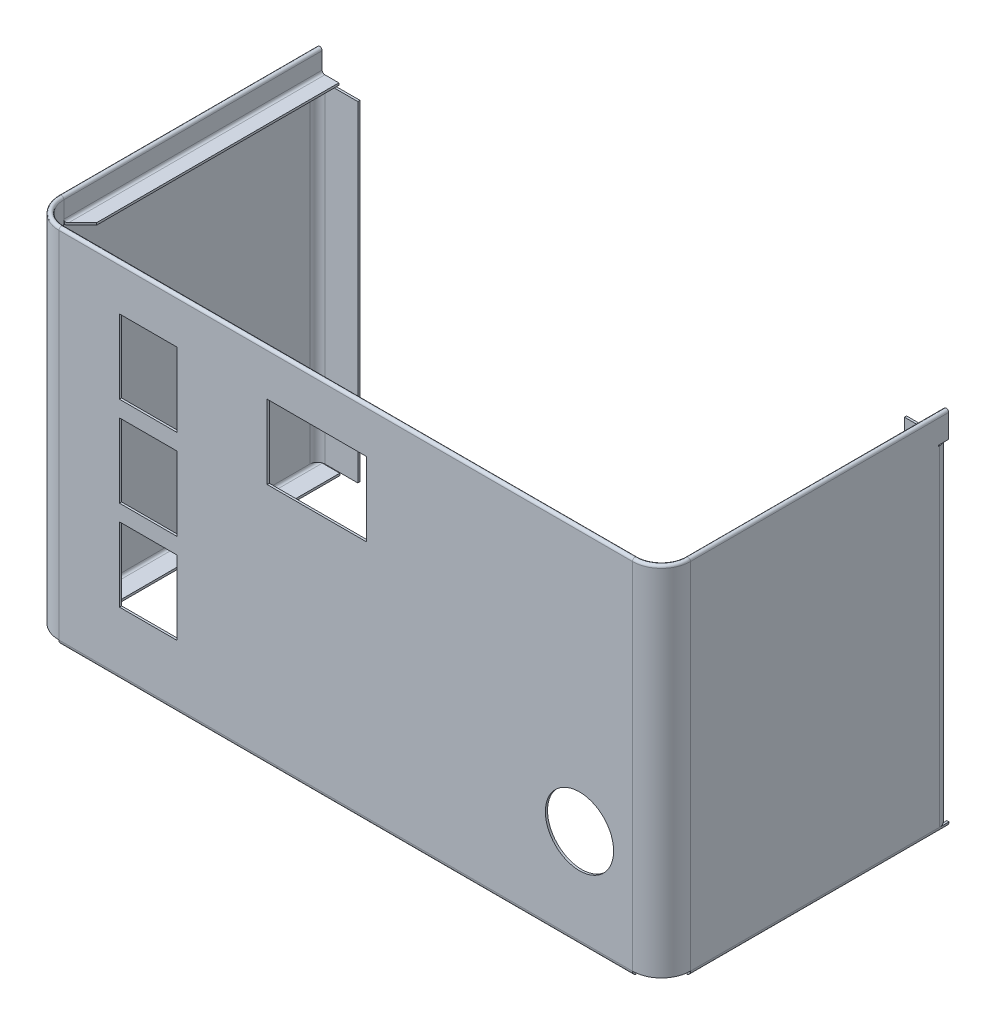
from build123d import *

# Parameters (mm, degrees)
BASE_FLANGE1_DEPTH        = 132
HEM2_START                = -107
HEM2_DEPTH                = 96.2
SKETCH31_R                = 12.7
CUT_EXTRUDE1_DEPTH        = 208.181817916
EDGE_FLANGE1_DEPTH        = 96.2
EDGE_FLANGE1_BEND_DEPTH   = 213.4
EDGE_FLANGE1_BEND_2_DEPTH = 96.2
CHAMFER1_SIZE             = 7
SKETCH41_W                = 21.5
SKETCH41_H                = 27.5
CUT_EXTRUDE2_DEPTH        = 208.181817916
LPATTERN1_COUNT           = 3
LPATTERN1_PITCH           = 33.5
SKETCH44_W                = 235
SKETCH44_H                = 10
CUT_EXTRUDE3_DEPTH        = 0.1
EDGE_FLANGE2_DEPTH        = 123.325
EDGE_FLANGE2_START        = 122.925
EDGE_FLANGE2_2_DEPTH      = 0.4
EDGE_FLANGE2_3_DEPTH      = 122.925
EDGE_FLANGE4_START        = -106.9
EDGE_FLANGE4_DEPTH        = 96.1
EDGE_FLANGE4_2_DEPTH      = 96.1
CHAMFER2_SIZE             = 6
SKETCH80_W                = 213.4
SKETCH80_H                = 1
BOSS_EXTRUDE1_DEPTH       = 7
FILLET1_R                 = 1
SKETCH92_W                = 37
SKETCH92_H                = 27.5
CUT_EXTRUDE4_DEPTH        = 208.181817916


# Read off the part's stored shape, not the designer's step: Hem2, Edge-Flange2, Edge-Flange4
# Sheet-metal steps are written as plain solids
with BuildPart() as part:
    # Sketch1 → Base-Flange1 (new body)
    with BuildSketch(Plane(origin=(0, 0, 0), x_dir=(1, 0, 0), z_dir=(0, 1, 0))):
        with BuildLine():
            Line((117.5, 107), (117.5, 10.8))
            ThreePointArc((117.5, 10.8), (114.336753237, 3.163246763), (106.7, 0))
            Line((106.7, 0), (0, 0))
            Line((0, 0), (-106.7, 0))
            ThreePointArc((-106.7, 0), (-114.336753237, 3.163246763), (-117.5, 10.8))
            Line((-117.5, 10.8), (-117.5, 107))
            Line((-117.5, 107), (-116.7, 107))
            Line((-116.7, 107), (-116.7, 10.8))
            ThreePointArc((-116.7, 10.8), (-113.771067812, 3.728932188), (-106.7, 0.8))
            Line((-106.7, 0.8), (0, 0.8))
            Line((0, 0.8), (106.7, 0.8))
            ThreePointArc((106.7, 0.8), (113.771067812, 3.728932188), (116.7, 10.8))
            Line((116.7, 10.8), (116.7, 107))
            Line((116.7, 107), (117.5, 107))
        make_face()
    extrude(amount=BASE_FLANGE1_DEPTH)

    # Hem2 outline → Hem2 (add)
    with BuildSketch(Plane.XY.offset(HEM2_START)):
        with BuildLine():
            Line((-116.45, 123.925), (-115.65, 123.925))
            Line((-115.65, 123.925), (-115.65, 132))
            ThreePointArc((-115.65, 132), (-116.575, 132.925), (-117.5, 132))
            Line((-117.5, 132), (-116.7, 132))
            ThreePointArc((-116.7, 132), (-116.575, 132.125), (-116.45, 132))
            Line((-116.45, 132), (-116.45, 123.925))
        make_face()
        with BuildLine():
            Line((115.65, 123.925), (116.45, 123.925))
            Line((116.45, 123.925), (116.45, 132))
            ThreePointArc((116.45, 132), (116.575, 132.125), (116.7, 132))
            Line((116.7, 132), (117.5, 132))
            ThreePointArc((117.5, 132), (116.575, 132.925), (115.65, 132))
            Line((115.65, 132), (115.65, 123.925))
        make_face()
    extrude(amount=HEM2_DEPTH)

    # Sweep1: sweep along a path in Sketch30
    with BuildLine(Plane(origin=(0, 132, 0), x_dir=(1, 0, 0), z_dir=(0, 1, 0))) as sweep1_path:
        ThreePointArc((-116.7, 10.8), (-113.771067812, 3.728932188), (-106.7, 0.8))
        Line((-106.7, 0.8), (106.7, 0.8))
        ThreePointArc((106.7, 0.8), (113.771067812, 3.728932188), (116.7, 10.8))
    # Sketch29 → Sweep1 (sweep)
    with BuildSketch(Plane.XY.offset(-10.8)):
        with BuildLine():
            Line((-117.5, 132), (-116.7, 132))
            ThreePointArc((-116.7, 132), (-116.575, 132.125), (-116.45, 132))
            Line((-116.45, 132), (-116.45, 123.925))
            Line((-116.45, 123.925), (-115.65, 123.925))
            Line((-115.65, 123.925), (-115.65, 132))
            ThreePointArc((-115.65, 132), (-116.575, 132.925), (-117.5, 132))
        make_face()
    sweep(path=sweep1_path.line)

    # Sketch31 → Cut-Extrude1 (cut, through all)
    with BuildSketch(Plane.XY):
        with Locations((87, 35.2)):
            Circle(SKETCH31_R)
    extrude(amount=-CUT_EXTRUDE1_DEPTH, mode=Mode.SUBTRACT)

    # Edge-Flange1 section (across the edge) → Edge-Flange1 (add)
    with BuildSketch(Plane(origin=(-116.7, -1, -10.8), x_dir=(0, 1, 0), z_dir=(0, 0, -1))):
        with BuildLine():
            Line((-0.8, 1), (-0.8, 7.5))
            Line((-0.8, 7.5), (0, 7.5))
            Line((0, 7.5), (0, 1))
            ThreePointArc((0, 1), (0.292893219, 0.292893219), (1, 0))
            Line((1, 0), (1, -0.8))
            ThreePointArc((1, -0.8), (-0.272792206, -0.272792206), (-0.8, 1))
        make_face()
    extrude(amount=EDGE_FLANGE1_DEPTH)

    # Edge-Flange1 section 2 (across the edge) → Edge-Flange1 bend (add)
    with BuildSketch(Plane(origin=(106.7, -1, -0.8), x_dir=(0, 1, 0), z_dir=(-1, 0, 0))):
        with BuildLine():
            Line((-0.8, 1), (-0.8, 7.5))
            Line((-0.8, 7.5), (0, 7.5))
            Line((0, 7.5), (0, 1))
            ThreePointArc((0, 1), (0.292893219, 0.292893219), (1, 0))
            Line((1, 0), (1, -0.8))
            ThreePointArc((1, -0.8), (-0.272792206, -0.272792206), (-0.8, 1))
        make_face()
    extrude(amount=EDGE_FLANGE1_BEND_DEPTH)

    # Edge-Flange1 section 3 (across the edge) → Edge-Flange1 bend 2 (add)
    with BuildSketch(Plane(origin=(116.7, -1, -107), x_dir=(0, 1, 0), z_dir=(0, 0, 1))):
        with BuildLine():
            Line((-0.8, 1), (-0.8, 7.5))
            Line((-0.8, 7.5), (0, 7.5))
            Line((0, 7.5), (0, 1))
            ThreePointArc((0, 1), (0.292893219, 0.292893219), (1, 0))
            Line((1, 0), (1, -0.8))
            ThreePointArc((1, -0.8), (-0.272792206, -0.272792206), (-0.8, 1))
        make_face()
    extrude(amount=EDGE_FLANGE1_BEND_2_DEPTH)

    # Chamfer1
    chamfer1_edges = [part.edges().sort_by_distance(p)[0] for p in [
        (106.7, -1.4, -8.3),
        (109.2, -1.4, -10.8),
        (-106.7, -1.4, -8.3),
        (-109.2, -1.4, -10.8),
    ]]
    chamfer(chamfer1_edges, length=CHAMFER1_SIZE)

    # Sketch41 → Cut-Extrude2 (cut, through all)
    with BuildSketch(Plane.XY):
        with Locations((-73.45, 102.6)):
            Rectangle(SKETCH41_W, SKETCH41_H)
    cut_extrude2 = extrude(amount=-CUT_EXTRUDE2_DEPTH, mode=Mode.SUBTRACT)

    # LPattern1: Cut-Extrude2 ×3
    with Locations(*[(0, -i * LPATTERN1_PITCH, 0) for i in range(1, LPATTERN1_COUNT)]):
        add(cut_extrude2, mode=Mode.SUBTRACT)

    # Sketch44 → Cut-Extrude3 (cut)
    with BuildSketch(Plane(origin=(0, 0, -107), x_dir=(-1, 0, 0), z_dir=(0, 0, -1))):
        with Locations((0, 127.925)):
            Rectangle(SKETCH44_W, SKETCH44_H)
    extrude(amount=-CUT_EXTRUDE3_DEPTH, mode=Mode.SUBTRACT)

    # Edge-Flange2 outline → Edge-Flange2 (cut)
    with BuildSketch(Plane(origin=(0, 0, 0), x_dir=(1, 0, 0), z_dir=(0, 1, 0))):
        with BuildLine():
            ThreePointArc((116.7, 105.662741699), (117.29411255, 104.6), (117.5, 103.4))
            Line((117.5, 103.4), (117.5, 107))
            Line((117.5, 107), (116.7, 107))
            Line((116.7, 107), (116.7, 105.662741699))
        make_face()
        with BuildLine():
            ThreePointArc((-117.5, 103.4), (-117.29411255, 104.6), (-116.7, 105.662741699))
            Line((-116.7, 105.662741699), (-116.7, 107))
            Line((-116.7, 107), (-117.5, 107))
            Line((-117.5, 107), (-117.5, 103.4))
        make_face()
    extrude(amount=EDGE_FLANGE2_DEPTH, mode=Mode.SUBTRACT)

    # Edge-Flange2 2 outline → Edge-Flange2 2 (cut)
    with BuildSketch(Plane(origin=(0, 0, 0), x_dir=(1, 0, 0), z_dir=(0, 1, 0)).offset(EDGE_FLANGE2_START)):
        with BuildLine():
            ThreePointArc((117.5, 103.4), (117.29411255, 104.6), (116.7, 105.662741699))
            Line((116.7, 105.662741699), (116.7, 103))
            Line((116.7, 103), (117.5, 103))
            Line((117.5, 103), (117.5, 103.4))
        make_face()
        with BuildLine():
            Line((-116.7, 103), (-116.7, 105.662741699))
            ThreePointArc((-116.7, 105.662741699), (-117.29411255, 104.6), (-117.5, 103.4))
            Line((-117.5, 103.4), (-117.5, 103))
            Line((-117.5, 103), (-116.7, 103))
        make_face()
    extrude(amount=EDGE_FLANGE2_2_DEPTH, mode=Mode.SUBTRACT)

    # Edge-Flange2 3 outline → Edge-Flange2 3 (add)
    with BuildSketch(Plane(origin=(0, 0, 0), x_dir=(1, 0, 0), z_dir=(0, 1, 0))):
        with BuildLine():
            Line((113.9, 107), (101.7, 107))
            Line((101.7, 107), (101.7, 106.2))
            Line((101.7, 106.2), (113.9, 106.2))
            ThreePointArc((113.9, 106.2), (115.879898987, 105.379898987), (116.7, 103.4))
            Line((116.7, 103.4), (116.7, 105.662741699))
            ThreePointArc((116.7, 105.662741699), (115.451471863, 106.648528137), (113.9, 107))
        make_face()
        with BuildLine():
            Line((-101.7, 107), (-113.9, 107))
            ThreePointArc((-113.9, 107), (-115.451471863, 106.648528137), (-116.7, 105.662741699))
            Line((-116.7, 105.662741699), (-116.7, 103.4))
            ThreePointArc((-116.7, 103.4), (-115.879898987, 105.379898987), (-113.9, 106.2))
            Line((-113.9, 106.2), (-101.7, 106.2))
            Line((-101.7, 106.2), (-101.7, 107))
        make_face()
    extrude(amount=EDGE_FLANGE2_3_DEPTH)

    # Edge-Flange4 outline → Edge-Flange4 (cut)
    with BuildSketch(Plane.XY.offset(EDGE_FLANGE4_START)):
        with BuildLine():
            ThreePointArc((116.45, 125.725), (116.237450787, 124.876471863), (115.65, 124.228337046))
            Line((115.65, 124.228337046), (115.65, 123.925))
            Line((115.65, 123.925), (116.45, 123.925))
            Line((116.45, 123.925), (116.45, 125.725))
        make_face()
        with BuildLine():
            Line((-115.65, 123.925), (-115.65, 124.228337046))
            ThreePointArc((-115.65, 124.228337046), (-116.237450787, 124.876471863), (-116.45, 125.725))
            Line((-116.45, 125.725), (-116.45, 123.925))
            Line((-116.45, 123.925), (-115.65, 123.925))
        make_face()
    extrude(amount=EDGE_FLANGE4_DEPTH, mode=Mode.SUBTRACT)

    # Edge-Flange4 2 outline → Edge-Flange4 2 (add)
    with BuildSketch(Plane.XY.offset(EDGE_FLANGE4_START)):
        with BuildLine():
            Line((109.45, 123.925), (114.65, 123.925))
            ThreePointArc((114.65, 123.925), (115.172497216, 124.002502784), (115.65, 124.228337046))
            Line((115.65, 124.228337046), (115.65, 125.725))
            ThreePointArc((115.65, 125.725), (115.357106781, 125.017893219), (114.65, 124.725))
            Line((114.65, 124.725), (109.45, 124.725))
            Line((109.45, 124.725), (109.45, 123.925))
        make_face()
        with BuildLine():
            Line((-114.65, 123.925), (-109.45, 123.925))
            Line((-109.45, 123.925), (-109.45, 124.725))
            Line((-109.45, 124.725), (-114.65, 124.725))
            ThreePointArc((-114.65, 124.725), (-115.357106781, 125.017893219), (-115.65, 125.725))
            Line((-115.65, 125.725), (-115.65, 124.228337046))
            ThreePointArc((-115.65, 124.228337046), (-115.172497216, 124.002502784), (-114.65, 123.925))
        make_face()
    extrude(amount=EDGE_FLANGE4_2_DEPTH)

    # Chamfer2
    chamfer2_edges = [part.edges().sort_by_distance(p)[0] for p in [
        (-109.45, 124.325, -10.8),
        (109.45, 124.325, -10.8),
    ]]
    chamfer(chamfer2_edges, length=CHAMFER2_SIZE)

    # Sketch80 → Boss-Extrude1 (add)
    with BuildSketch(Plane(origin=(0, 0, -1.85), x_dir=(-1, 0, 0), z_dir=(0, 0, -1))):
        with Locations((0, 124.425)):
            Rectangle(SKETCH80_W, SKETCH80_H)
    extrude(amount=BOSS_EXTRUDE1_DEPTH)

    # Fillet1
    fillet1_edges = [part.edges().sort_by_distance(p)[0] for p in [
        (0, 124.925, -1.85),
    ]]
    fillet(fillet1_edges, radius=FILLET1_R)

    # Sketch92 → Cut-Extrude4 (cut, through all)
    with BuildSketch(Plane.XY):
        with Locations((-10.7, 102.6)):
            Rectangle(SKETCH92_W, SKETCH92_H)
    extrude(amount=-CUT_EXTRUDE4_DEPTH, mode=Mode.SUBTRACT)


solid = part.part
